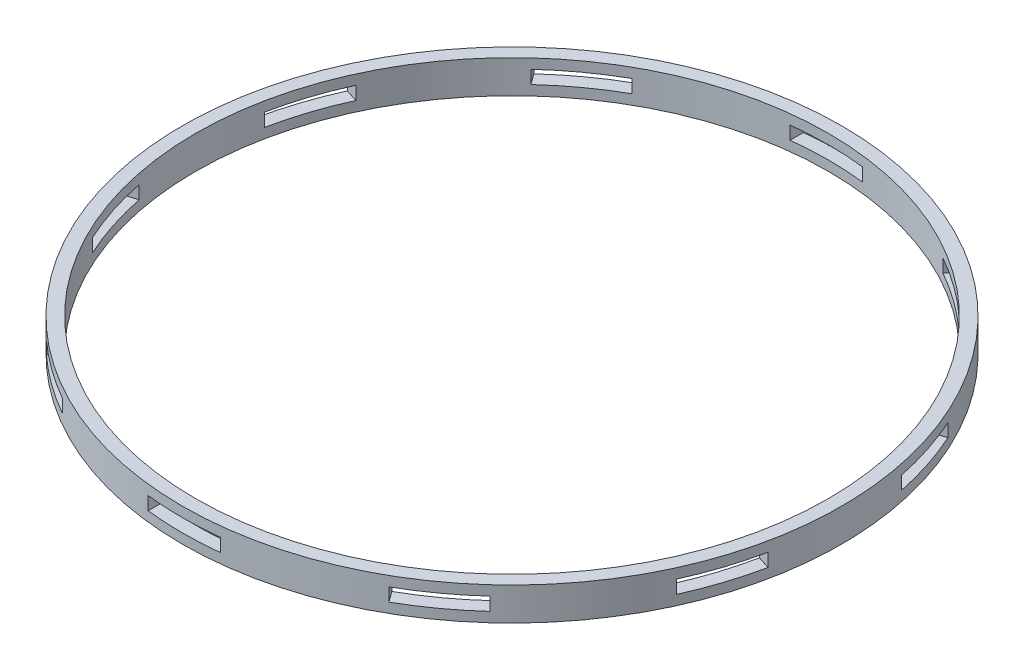
from build123d import *

# Parameters (mm, degrees)
SKETCH1_R           = 100
SKETCH1_R_2         = 96
BOSS_EXTRUDE1_DEPTH = 10
SKETCH2_W           = 22
SKETCH2_H           = 4
CUT_EXTRUDE1_DEPTH  = 142.774468788
CIRPATTERN1_COUNT   = 10


with BuildPart() as part:
    # Sketch1 → Boss-Extrude1 (new body)
    with BuildSketch(Plane(origin=(0, 0, 0), x_dir=(1, 0, 0), z_dir=(0, 1, 0))):
        Circle(SKETCH1_R)
        Circle(SKETCH1_R_2, mode=Mode.SUBTRACT)
    extrude(amount=BOSS_EXTRUDE1_DEPTH)

    # Sketch2 → Cut-Extrude1 (cut, through all)
    with BuildSketch(Plane.XY):
        with Locations((0, 5)):
            Rectangle(SKETCH2_W, SKETCH2_H)
    cut_extrude1 = extrude(amount=-CUT_EXTRUDE1_DEPTH, mode=Mode.SUBTRACT)

    # CirPattern1: Cut-Extrude1 ×10 about axis
    cirpattern1_axis = Axis((0, 10, 0), (0, -1, 0))
    for i in range(1, CIRPATTERN1_COUNT):
        add(cut_extrude1.rotate(cirpattern1_axis, i * 360 / CIRPATTERN1_COUNT), mode=Mode.SUBTRACT)


solid = part.part
